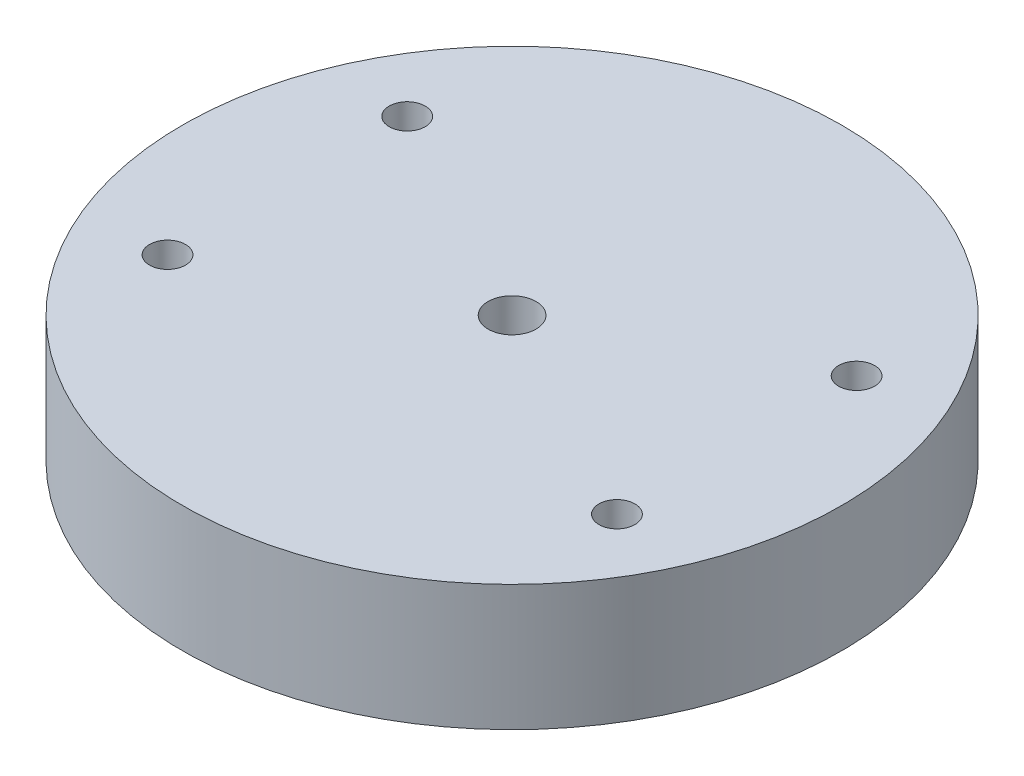
from build123d import *

# Parameters (mm, degrees)
SKETCH1_R               = 55
SKETCH1_R_2             = 4
BOSS_EXTRUDE1_DEPTH     = 21
CUT_EXTRUDE3_DEPTH      = 81.566742518
CUT_EXTRUDE3_DEPTH_BACK = 10
SKETCH2_R               = 3
SKETCH3_R               = 5
CUT_EXTRUDE4_DEPTH      = 5


with BuildPart() as part:
    # Sketch1 → Boss-Extrude1 (new body)
    with BuildSketch(Plane(origin=(0, 0, 0), x_dir=(1, 0, 0), z_dir=(0, 1, 0))):
        Circle(SKETCH1_R)
        Circle(SKETCH1_R_2, mode=Mode.SUBTRACT)
    extrude(amount=BOSS_EXTRUDE1_DEPTH)

    # Sketch2 → Cut-Extrude3 (cut, two sides: drawn at the far end of the back side and taken through both)
    with BuildSketch(Plane(origin=(0, 0, 0), x_dir=(1, 0, 0), z_dir=(0, 1, 0)).offset(-CUT_EXTRUDE3_DEPTH_BACK)):
        with Locations((-37.5, 20)):
            Circle(SKETCH2_R)
        with Locations((-37.5, -20)):
            Circle(SKETCH2_R)
        with Locations((37.5, -20)):
            Circle(SKETCH2_R)
        with Locations((37.5, 20)):
            Circle(SKETCH2_R)
    extrude(amount=CUT_EXTRUDE3_DEPTH + CUT_EXTRUDE3_DEPTH_BACK, mode=Mode.SUBTRACT)

    # Sketch3 → Cut-Extrude4 (cut)
    with BuildSketch(Plane(origin=(0, 0, 0), x_dir=(1, 0, 0), z_dir=(0, 1, 0))):
        with Locations((-37.5, 20)):
            Circle(SKETCH3_R)
        with Locations((-37.5, -20)):
            Circle(SKETCH3_R)
        with Locations((37.5, 20)):
            Circle(SKETCH3_R)
        with Locations((37.5, -20)):
            Circle(SKETCH3_R)
    extrude(amount=CUT_EXTRUDE4_DEPTH, mode=Mode.SUBTRACT)


solid = part.part
